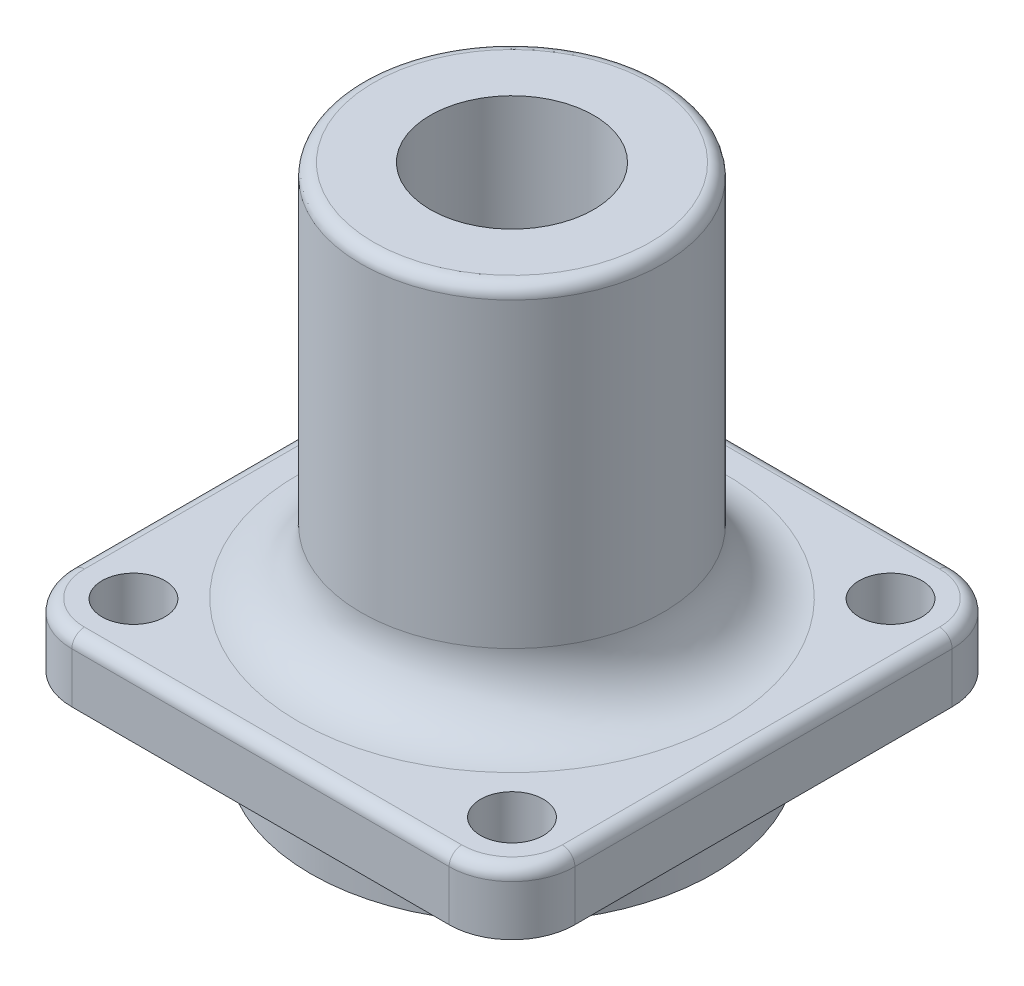
from build123d import *

# Parameters (mm, degrees)
BOSS_EXTRUDE13_OUTLINE_W = 40
BOSS_EXTRUDE13_OUTLINE_H = 40
BOSS_EXTRUDE13_OUTLINE_R = 2.5
BOSS_EXTRUDE13_DEPTH     = 5
SKETCH3_R                = 12
BOSS_EXTRUDE17_DEPTH     = 30
FILLET2_R                = 1
FILLET3_R                = 5
FILLET4_R                = 1
SKETCH6_R                = 16
BOSS_EXTRUDE18_DEPTH     = 6
SKETCH5_R                = 6.5
CUT_EXTRUDE2_DEPTH       = 55


# Read off the part's stored shape, not the designer's step: Boss-Extrude13
with BuildPart() as part:
    # Boss-Extrude13 outline → Boss-Extrude13 (new body)
    with BuildSketch(Plane(origin=(0, 0, 0), x_dir=(1, 0, 0), z_dir=(0, 1, 0))):
        Rectangle(BOSS_EXTRUDE13_OUTLINE_W, BOSS_EXTRUDE13_OUTLINE_H)
        with Locations((-15, -15.102802021)):
            Circle(BOSS_EXTRUDE13_OUTLINE_R, mode=Mode.SUBTRACT)
        with Locations((15.102802021, -15.102802021)):
            Circle(BOSS_EXTRUDE13_OUTLINE_R, mode=Mode.SUBTRACT)
        with Locations((-15, 15)):
            Circle(BOSS_EXTRUDE13_OUTLINE_R, mode=Mode.SUBTRACT)
        with Locations((15.102802021, 15)):
            Circle(BOSS_EXTRUDE13_OUTLINE_R, mode=Mode.SUBTRACT)
    extrude(amount=BOSS_EXTRUDE13_DEPTH)

    # Sketch3 → Boss-Extrude17 (add)
    with BuildSketch(Plane(origin=(0, 5, 0), x_dir=(1, 0, 0), z_dir=(0, 1, 0))):
        with Locations(Location((0, 0, 0), (0, 0, 270))):
            Circle(SKETCH3_R)
    extrude(amount=BOSS_EXTRUDE17_DEPTH)

    # Fillet2
    fillet2_edges = [part.edges().sort_by_distance(p)[0] for p in [
        (20, 5, 0),
        (0, 5, -20),
        (-20, 5, 0),
        (0, 5, 20),
    ]]
    fillet(fillet2_edges, radius=FILLET2_R)

    # Fillet3
    # the kernel refuses this fillet: 5 mm, written as the material it adds along each edge
    with BuildSketch(Plane(origin=(0, 5, 0), x_dir=(0, 0, 1), z_dir=(-1, 0, 0))) as fillet3_piece_1:
        with BuildLine():
            CenterArc((12 + FILLET3_R, FILLET3_R), FILLET3_R, 180, 90)
            Line((12, FILLET3_R), (12, 0))
            Line((12, 0), (12 + FILLET3_R, 0))
        make_face()
    revolve(axis=Axis((0, 5, 0), (0, 1, 0)))
    # the kernel refuses this fillet: 5 mm, written as the material it takes off along each edge
    with BuildSketch(Plane(origin=(-15, 5, -15), x_dir=(0, 0, -1), z_dir=(1, 0, 0))) as fillet3_2_piece_1:
        with BuildLine():
            CenterArc((4, -1), 1, 0, 90)
            Line((5, -1), (5, 0))
            Line((5, 0), (4, 0))
        make_face()
    revolve(axis=Axis((-15, 5, -15), (0, 1, 0)), revolution_arc=90, mode=Mode.SUBTRACT)
    with BuildSketch(Plane(origin=(15, 5, -15), x_dir=(1, 0, 0), z_dir=(0, 0, 1))) as fillet3_2_piece_2:
        with BuildLine():
            CenterArc((4, -1), 1, 0, 90)
            Line((5, -1), (5, 0))
            Line((5, 0), (4, 0))
        make_face()
    revolve(axis=Axis((15, 5, -15), (0, 1, 0)), revolution_arc=90, mode=Mode.SUBTRACT)
    with BuildSketch(Plane(origin=(-15, 5, 15), x_dir=(-1, 0, 0), z_dir=(0, 0, -1))) as fillet3_2_piece_3:
        with BuildLine():
            CenterArc((4, -1), 1, 0, 90)
            Line((5, -1), (5, 0))
            Line((5, 0), (4, 0))
        make_face()
    revolve(axis=Axis((-15, 5, 15), (0, 1, 0)), revolution_arc=90, mode=Mode.SUBTRACT)
    with BuildSketch(Plane(origin=(15, 5, 15), x_dir=(0, 0, 1), z_dir=(-1, 0, 0))) as fillet3_2_piece_4:
        with BuildLine():
            CenterArc((4, -1), 1, 0, 90)
            Line((5, -1), (5, 0))
            Line((5, 0), (4, 0))
        make_face()
    revolve(axis=Axis((15, 5, 15), (0, 1, 0)), revolution_arc=90, mode=Mode.SUBTRACT)
    with BuildSketch(Plane(origin=(20, -12.5, 20), x_dir=(-1, 0, 0), z_dir=(0, 1, 0)), Plane(origin=(20, -12.5, -20), x_dir=(0, 0, 1), z_dir=(0, 1, 0))) as fillet3_2_piece_5:
        with BuildLine():
            CenterArc((FILLET3_R, -FILLET3_R), FILLET3_R, 90, 90)
            Line((0, -FILLET3_R), (0, 0))
            Line((0, 0), (FILLET3_R, 0))
        make_face()
    extrude(amount=17.5, mode=Mode.SUBTRACT)
    with BuildSketch(Plane(origin=(-20, -12.5, 20), x_dir=(1, 0, 0), z_dir=(0, 1, 0)), Plane(origin=(-20, -12.5, -20), x_dir=(0, 0, 1), z_dir=(0, 1, 0))) as fillet3_2_piece_6:
        with BuildLine():
            CenterArc((FILLET3_R, FILLET3_R), FILLET3_R, 180, 90)
            Line((0, FILLET3_R), (0, 0))
            Line((0, 0), (FILLET3_R, 0))
        make_face()
    extrude(amount=17.5, mode=Mode.SUBTRACT)

    # Fillet4
    fillet4_edges = [part.edges().sort_by_distance(p)[0] for p in [
        (0, 35, -12),
    ]]
    fillet(fillet4_edges, radius=FILLET4_R)

    # Sketch6 → Boss-Extrude18 (add)
    with BuildSketch(Plane.XZ):
        with Locations(Location((0, 0, 0), (0, 0, 90))):
            Circle(SKETCH6_R)
    extrude(amount=BOSS_EXTRUDE18_DEPTH)

    # Sketch5 → Cut-Extrude2 (cut)
    with BuildSketch(Plane(origin=(0, 35, 0), x_dir=(1, 0, 0), z_dir=(0, 1, 0))):
        with Locations(Location((0, 0, 0), (0, 0, 270))):
            Circle(SKETCH5_R)
    extrude(amount=-CUT_EXTRUDE2_DEPTH, mode=Mode.SUBTRACT)


solid = part.part
